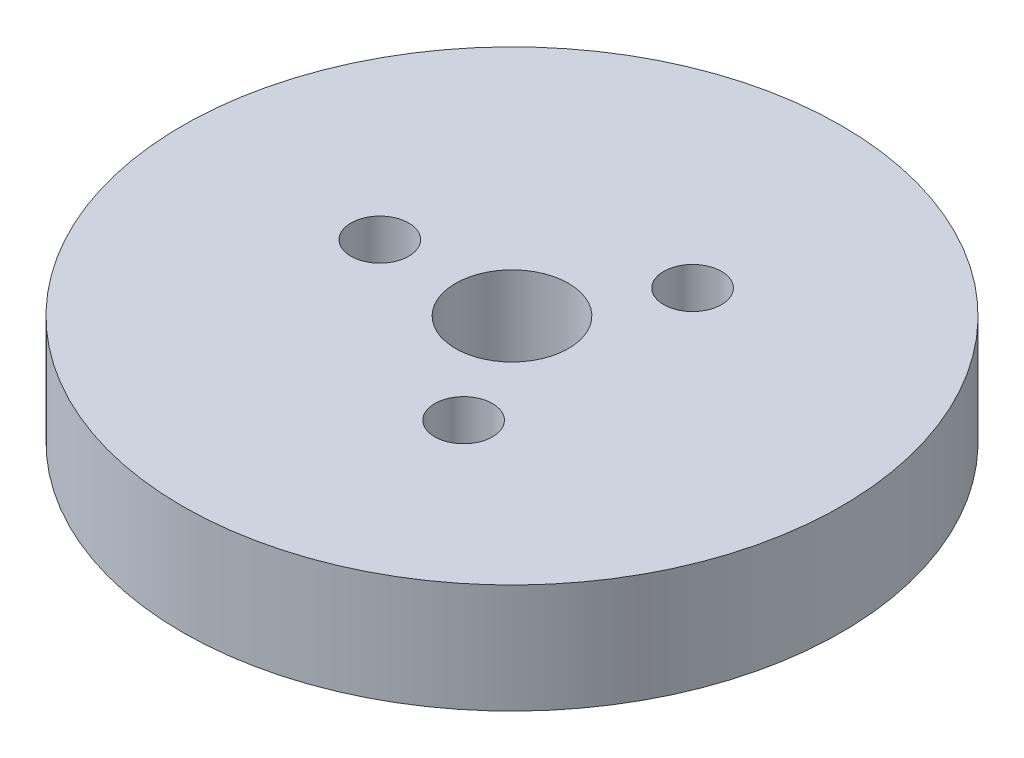
from build123d import *

# Parameters (mm, degrees)
SKETCH1_R           = 87.5
BOSS_EXTRUDE1_DEPTH = 29
SKETCH2_R           = 15
CUT_EXTRUDE1_DEPTH  = 128.096420091
SKETCH3_R           = 7.666988893
CUT_EXTRUDE2_DEPTH  = 21.221624825
CIRPATTERN1_COUNT   = 3


with BuildPart() as part:
    # Sketch1 → Boss-Extrude1 (new body)
    with BuildSketch(Plane(origin=(0, 0, 0), x_dir=(1, 0, 0), z_dir=(0, 1, 0))):
        Circle(SKETCH1_R)
    extrude(amount=BOSS_EXTRUDE1_DEPTH)

    # Sketch2 → Cut-Extrude1 (cut, through all)
    with BuildSketch(Plane(origin=(0, 0, 0), x_dir=(1, 0, 0), z_dir=(0, 1, 0))):
        Circle(SKETCH2_R)
    extrude(amount=CUT_EXTRUDE1_DEPTH, mode=Mode.SUBTRACT)

    # Sketch3 → Cut-Extrude2 (cut)
    with BuildSketch(Plane(origin=(0, 29, 0), x_dir=(1, 0, 0), z_dir=(0, 1, 0))):
        with Locations((-35.094392614, 0)):
            Circle(SKETCH3_R)
    cut_extrude2 = extrude(amount=-CUT_EXTRUDE2_DEPTH, mode=Mode.SUBTRACT)

    # CirPattern1: Cut-Extrude2 ×3 about axis
    cirpattern1_axis = Axis((0, 0, 0), (0, 1, 0))
    for i in range(1, CIRPATTERN1_COUNT):
        add(cut_extrude2.rotate(cirpattern1_axis, i * 360 / CIRPATTERN1_COUNT), mode=Mode.SUBTRACT)


solid = part.part
